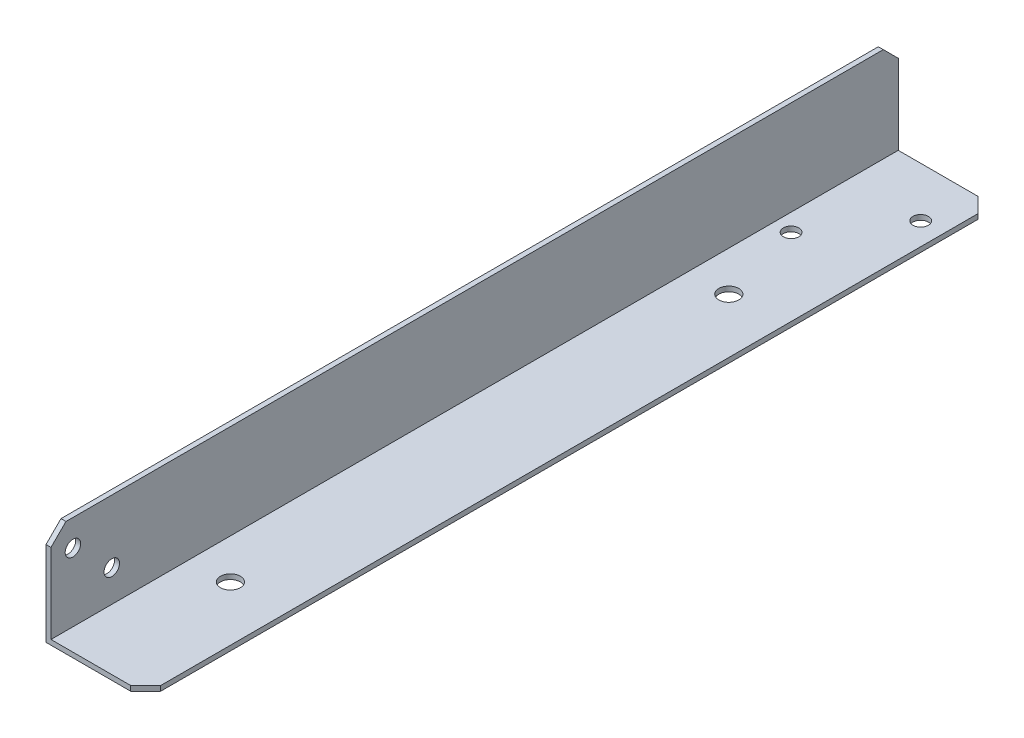
from build123d import *

# Parameters (mm, degrees)
BASE_DEPTH                      = 170
CHAMFER1_SIZE                   = 3
SKETCH4_R                       = 1.55
CARRIAGESIDE_DEPTH              = 173.002906952
F_4_0_4_CABLE_TIE_HOLES_D       = 4
F_3_1_3_1_CABLECHAINSIDEHOLES_D = 3.1


with BuildPart() as part:
    # Sketch1 → Base (new body)
    with BuildSketch(Plane.XY):
        Polygon((0, 0), (20, 0), (20, 1), (1, 1), (1, 20), (0, 20), align=None)
    extrude(amount=BASE_DEPTH)

    # Chamfer1
    chamfer1_edges = [part.edges().sort_by_distance(p)[0] for p in [
        (20, 0.5, 170),
        (0.5, 20, 170),
        (0.5, 20, 0),
        (20, 0.5, 0),
    ]]
    chamfer(chamfer1_edges, length=CHAMFER1_SIZE)

    # Sketch4 → CarriageSide (cut, through all)
    with BuildSketch(Plane(origin=(2, 1, 0), x_dir=(0, 0, -1), z_dir=(0, 1, 0))):
        with Locations((-10, -13.5)):
            Circle(SKETCH4_R)
        with Locations((-25, -2.5)):
            Circle(SKETCH4_R)
    extrude(amount=-CARRIAGESIDE_DEPTH, mode=Mode.SUBTRACT)

    # Ø4.0 (4) Cable tie Holes (through all)
    with Locations(Plane(origin=(0, 1, 0), x_dir=(1, 0, 0), z_dir=(0, 1, 0))):
        with Locations((9, -42), (9, -142)):
            Hole(F_4_0_4_CABLE_TIE_HOLES_D / 2)

    # Ø3.1 (3.1) CableChainSideHoles (through all)
    with Locations(Plane(origin=(1, 0, 0), x_dir=(0, 0, -1), z_dir=(1, 0, 0))):
        with Locations((-165.6, 14.68), (-157.8, 7.38)):
            Hole(F_3_1_3_1_CABLECHAINSIDEHOLES_D / 2)


solid = part.part
